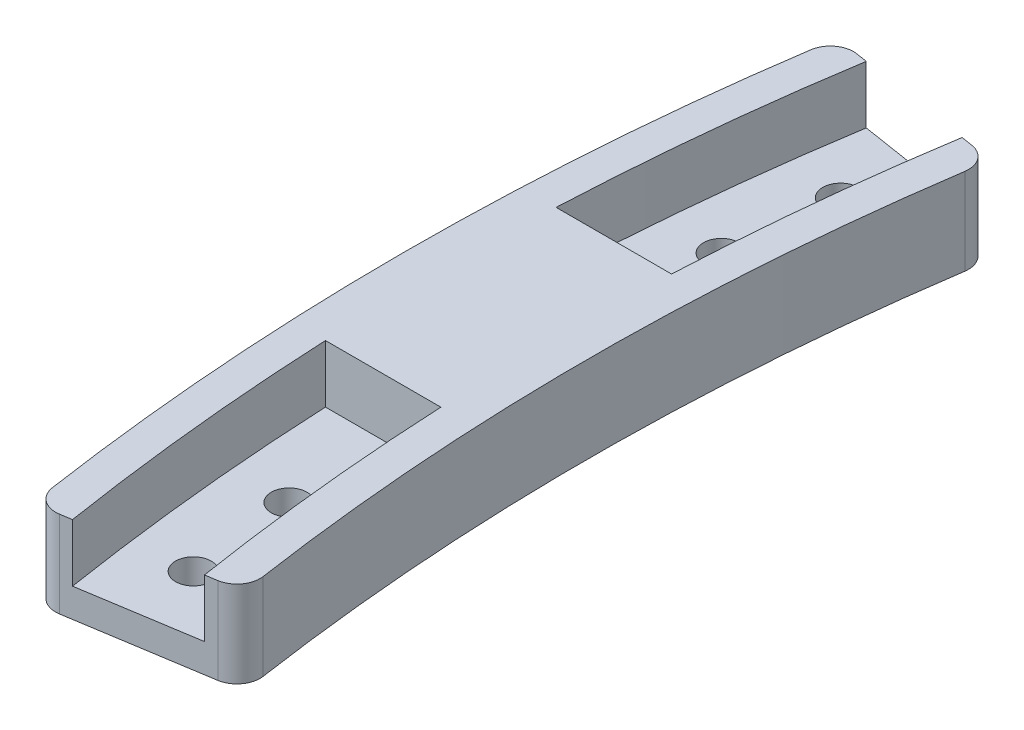
from build123d import *

# Parameters (mm, degrees)
BOSS_EXTRUDE1_DEPTH        = 10
CUT_EXTRUDE1_DEPTH         = 5
F_3_1_3_1_DIAMETER_HOLE2_D = 3.1
FILLET1_R                  = 2
CUT_EXTRUDE2_START         = -2.5
CUT_EXTRUDE2_DEPTH         = 2.5


with BuildPart() as part:
    # Sketch1 → Boss-Extrude1 (new body)
    with BuildSketch(Plane(origin=(0, 0, 0), x_dir=(1, 0, 0), z_dir=(0, 1, 0))):
        with BuildLine():
            Line((-220.254499953, -34.884885704), (-204.451486503, -32.381934263))
            ThreePointArc((-204.451486503, -32.381934263), (-207, 0), (-204.451486503, 32.381934263))
            Line((-204.451486503, 32.381934263), (-220.254499953, 34.884885704))
            ThreePointArc((-220.254499953, 34.884885704), (-223, 0), (-220.254499953, -34.884885704))
        make_face()
    extrude(amount=BOSS_EXTRUDE1_DEPTH)

    # Sketch15 → Cut-Extrude1 (cut)
    with BuildSketch(Plane(origin=(0, 10, 0), x_dir=(1, 0, 0), z_dir=(0, 1, 0))):
        with BuildLine():
            Line((-219.772609758, 10), (-209.761769634, 10))
            ThreePointArc((-209.761769634, 10), (-208.900850883, 21.457737542), (-207.414551525, 32.851237658))
            Line((-207.414551525, 32.851237658), (-217.291434931, 34.415582309))
            ThreePointArc((-217.291434931, 34.415582309), (-218.872736893, 22.242415451), (-219.772609758, 10))
        make_face()
        with BuildLine():
            ThreePointArc((-207.414551525, -32.851237658), (-208.900850883, -21.457737542), (-209.761769634, -10))
            Line((-209.761769634, -10), (-219.772609758, -10))
            ThreePointArc((-219.772609758, -10), (-218.872736893, -22.242415451), (-217.291434931, -34.415582309))
            Line((-217.291434931, -34.415582309), (-207.414551525, -32.851237658))
        make_face()
    extrude(amount=-CUT_EXTRUDE1_DEPTH, mode=Mode.SUBTRACT)

    # Ø3.1 (3.1) Diameter Hole2 (through all)
    with Locations(Plane(origin=(0, 0, 0), x_dir=(-1, 0, 0), z_dir=(0, -1, 0))):
        with Locations((213.160645195, -28.063131327), (214.18186009, -18.738484691), (214.18186009, 18.738484691), (213.160645195, 28.063131327)):
            Hole(F_3_1_3_1_DIAMETER_HOLE2_D / 2)

    # Fillet1
    fillet1_edges = [part.edges().sort_by_distance(p)[0] for p in [
        (-220.254499953, 5, -34.884885704),
        (-204.451486503, 5, -32.381934263),
        (-220.254499953, 5, 34.884885704),
        (-204.451486503, 5, 32.381934263),
    ]]
    fillet(fillet1_edges, radius=FILLET1_R)

    # Sketch19 → Cut-Extrude2 (cut)
    with BuildSketch(Plane.XZ.offset(CUT_EXTRUDE2_START)):
        with BuildLine():
            Line((-218.270184732, -34.570601048), (-206.417411405, -32.693306179))
            ThreePointArc((-206.417411405, -32.693306179), (-205.117889671, -31.901228423), (-204.75200014, -30.423978019))
            ThreePointArc((-204.75200014, -30.423978019), (-207, 0), (-204.75200014, 30.423978019))
            ThreePointArc((-204.75200014, 30.423978019), (-205.117889671, 31.901228423), (-206.417411405, 32.693306179))
            Line((-206.417411405, 32.693306179), (-218.270184732, 34.570601048))
            ThreePointArc((-218.270184732, 34.570601048), (-219.765933628, 34.207922413), (-220.561180845, 32.890203773))
            ThreePointArc((-220.561180845, 32.890203773), (-223, 0), (-220.561180845, -32.890203773))
            ThreePointArc((-220.561180845, -32.890203773), (-219.765933628, -34.207922413), (-218.270184732, -34.570601048))
        make_face()
    extrude(amount=CUT_EXTRUDE2_DEPTH, mode=Mode.SUBTRACT)


solid = part.part
